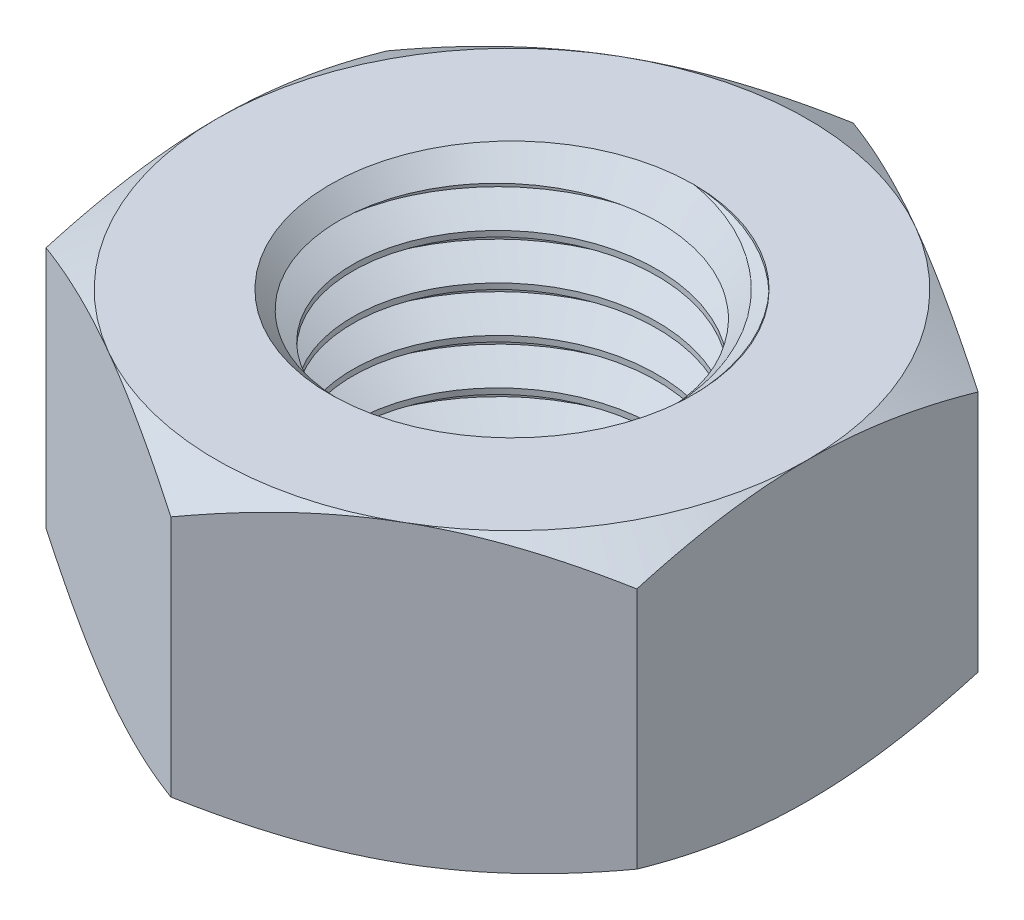
from build123d import *

# Parameters (mm, degrees)
SKETCH0_R               = 4
BOSS_EXTRUDE1_DEPTH     = 3.25
SKETCH5_OUTSIDE_W       = 63.752
SKETCH5_OUTSIDE_H       = 65.764
SKETCH5_OUTSIDE_R       = 6.5
CUT_EXTRUDE2_DEPTH      = 12.867322079
CUT_EXTRUDE2_DRAFT      = -60
MIRROR2_COPY_1_SKETCH_W = 63.752
MIRROR2_COPY_1_SKETCH_H = 65.764
MIRROR2_COPY_1_SKETCH_R = 6.5
MIRROR2_COPY_1_DEPTH    = 12.867322079
MIRROR2_COPY_1_DRAFT    = -60
SWEEP1_PITCH            = 1
SKETCH9_R               = 6.5
CUT_EXTRUDE4_DEPTH      = 14.090667015


# Read off the part's stored shape, not the designer's step: Cut-Extrude3
with BuildPart() as part:
    # Sketch0 → Boss-Extrude1 (new, symmetric)
    with BuildSketch(Plane(origin=(0, 0, 0), x_dir=(1, 0, 0), z_dir=(0, 1, 0))):
        Polygon((-6.5, 3.75277675), (-6.5, -3.75277675), (0, -7.505553499), (6.5, -3.75277675), (6.5, 3.75277675), (0, 7.505553499), align=None)
        with Locations(Location((0, 0, 0), (0, 0, 90))):
            Circle(SKETCH0_R, mode=Mode.SUBTRACT)
    extrude(amount=BOSS_EXTRUDE1_DEPTH, both=True)


with BuildPart() as cut_extrude2_tool:
    # Sketch5 outside → Cut-Extrude2 (with draft: the straight prism first)
    with BuildSketch(Plane(origin=(0, 3.25, 0), x_dir=(1, 0, 0), z_dir=(0, 1, 0))):
        Rectangle(SKETCH5_OUTSIDE_W, SKETCH5_OUTSIDE_H)
        Circle(SKETCH5_OUTSIDE_R, mode=Mode.SUBTRACT)
    extrude(amount=-CUT_EXTRUDE2_DEPTH)
    # Cut-Extrude2: the draft: its side faces are tilted about the plane it starts from
    cut_extrude2_sides = [cut_extrude2_tool.faces().sort_by_distance(p)[0] for p in [
        (0, -3.18366104, 32.882),
        (31.876, -3.18366104, 0),
        (0, -3.18366104, -32.882),
        (-31.876, -3.18366104, 0),
        (-6.5, -3.18366104, 0),
    ]]
    draft(cut_extrude2_sides, Plane(origin=(0, 3.25, 0), x_dir=(1, 0, 0), z_dir=(0, 1, 0)), CUT_EXTRUDE2_DRAFT)


with BuildPart() as part_1:
    add(part.part)

    # Cut-Extrude2: cut by cut_extrude2_tool
    add(cut_extrude2_tool.part, mode=Mode.SUBTRACT)


with BuildPart() as mirror2_copy_1_tool:
    # Mirror2 copy 1 sketch → Mirror2 copy 1 (with draft: the straight prism first)
    with BuildSketch(Plane.XZ.offset(3.25)):
        Rectangle(MIRROR2_COPY_1_SKETCH_W, MIRROR2_COPY_1_SKETCH_H)
        Circle(MIRROR2_COPY_1_SKETCH_R, mode=Mode.SUBTRACT)
    extrude(amount=-MIRROR2_COPY_1_DEPTH)
    # Mirror2 copy 1: the draft: its side faces are tilted about the plane it starts from
    mirror2_copy_1_sides = [mirror2_copy_1_tool.faces().sort_by_distance(p)[0] for p in [
        (0, 3.18366104, 32.882),
        (31.876, 3.18366104, 0),
        (0, 3.18366104, -32.882),
        (-31.876, 3.18366104, 0),
        (-6.5, 3.18366104, 0),
    ]]
    draft(mirror2_copy_1_sides, Plane.XZ.offset(3.25), MIRROR2_COPY_1_DRAFT)


with BuildPart() as part_2:
    add(part_1.part)

    # Mirror2 copy 1: cut by mirror2_copy_1_tool
    add(mirror2_copy_1_tool.part, mode=Mode.SUBTRACT)

    # Sweep1: the profile of Sketch6 screwed along a right-hand helix of 8.5 turns, 8 arcs to a turn; built about Z, then put on its axis
    sweep1_z = Axis((0, 0, 0), (0, 0, 1))
    sweep1_corners = [(4.054126588, 0, 0.03125), (4.054126588, 0, -0.90625), (3.350480947, 0, -0.5), (3.350480947, 0, -0.375)]
    with BuildLine(mode=Mode.PRIVATE) as sweep1_profile:
        Line(sweep1_corners[0], sweep1_corners[1])
        Line(sweep1_corners[1], sweep1_corners[2])
        Line(sweep1_corners[2], sweep1_corners[3])
        Line(sweep1_corners[3], sweep1_corners[0])
    sweep1_cap = Face(sweep1_profile.wire())
    sweep1_turn_angles = [0, 22.5, 45, 67.5, 90, 112.5, 135, 157.5, 180, 202.5, 225, 247.5, 270, 292.5, 315, 337.5, 360]
    sweep1_turn_weights = [1, 0.9238795325112867, 1, 0.9238795325112867, 1, 0.9238795325112867, 1, 0.9238795325112867, 1, 0.9238795325112867, 1, 0.9238795325112867, 1, 0.9238795325112867, 1, 0.9238795325112867, 1]
    sweep1_turn_rails = [Edge.make_bspline([Vector(p[0], p[1], 0).rotate(sweep1_z, sweep1_turn_angles[k]) / sweep1_turn_weights[k] + Vector(0, 0, p[2] + SWEEP1_PITCH * sweep1_turn_angles[k] / 360) for k in range(17)], [0, 0, 0, 1, 1, 2, 2, 3, 3, 4, 4, 5, 5, 6, 6, 7, 7, 8, 8, 8], 2, sweep1_turn_weights) for p in sweep1_corners]
    sweep1_turn_sides = [Face.make_surface_from_curves(sweep1_turn_rails[p[0]], sweep1_turn_rails[p[1]]) for p in [(0, 1), (1, 2), (2, 3), (3, 0)]]
    sweep1_last_angles = [2880, 2902.5, 2925, 2947.5, 2970, 2992.5, 3015, 3037.5, 3060]
    sweep1_last_weights = [1, 0.9238795325112867, 1, 0.9238795325112867, 1, 0.9238795325112867, 1, 0.9238795325112761, 1]
    sweep1_last_rails = [Edge.make_bspline([Vector(p[0], p[1], 0).rotate(sweep1_z, sweep1_last_angles[k]) / sweep1_last_weights[k] + Vector(0, 0, p[2] + SWEEP1_PITCH * sweep1_last_angles[k] / 360) for k in range(9)], [0, 0, 0, 1, 1, 2, 2, 3, 3, 4, 4, 4], 2, sweep1_last_weights) for p in sweep1_corners]
    sweep1_last_sides = [Face.make_surface_from_curves(sweep1_last_rails[p[0]], sweep1_last_rails[p[1]]) for p in [(0, 1), (1, 2), (2, 3), (3, 0)]]
    sweep1 = Plane(origin=(0, -3.25, 0), x_dir=(0, 0, 1), z_dir=(0, 1, 0)) * Solid(Shell([*[p.moved(Location((0, 0, SWEEP1_PITCH * i))) for i in range(8) for p in sweep1_turn_sides], *sweep1_last_sides, sweep1_cap, sweep1_cap.rotate(sweep1_z, 3060).moved(Location((0, 0, SWEEP1_PITCH * 3060 / 360)))]))
    add(sweep1)

    # Sketch9 → Cut-Extrude4 (cut, through all)
    with BuildSketch(Plane.XZ.offset(3.25)):
        Circle(SKETCH9_R)
    cut_extrude4 = extrude(amount=CUT_EXTRUDE4_DEPTH, mode=Mode.SUBTRACT)

    # Cut-Extrude3 outline → Cut-Extrude3 (revolve, cut)
    with BuildSketch(Plane.XY):
        Polygon((3.350475328, 2.600475328), (4.054130071, 3.304130071), (4.054130071, 5.2812501), (3.350475328, 5.2812501), align=None)
    cut_extrude3 = revolve(axis=Axis((0, 0, 0), (0, 1, 0)), mode=Mode.SUBTRACT)

    # Mirror3: Cut-Extrude4, Cut-Extrude3 across plane
    add(cut_extrude4.mirror(Plane.ZX), mode=Mode.SUBTRACT)
    add(cut_extrude3.mirror(Plane.ZX), mode=Mode.SUBTRACT)


solid = part_2.part
